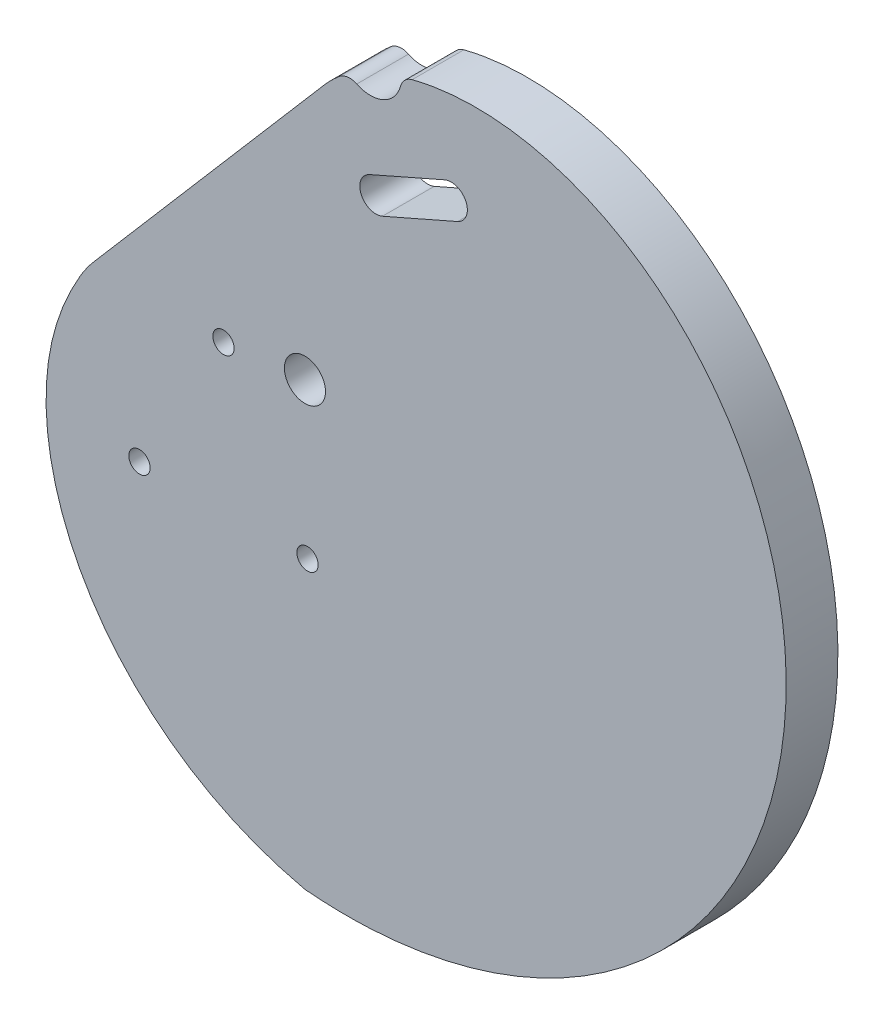
from build123d import *

# Parameters (mm, degrees)
SKETCH1_R             = 3.175
BOSS_EXTRUDE1_DEPTH   = 4
CUT_EXTRUDE1_START    = -4
CUT_EXTRUDE1_DEPTH    = 8
FILLET1_START         = -5
FILLET1_DEPTH         = 10
M4X0_7_TAPPED_HOLE1_D = 3.3
FILLET2_R             = 2.5


with BuildPart() as part:
    # Sketch1 → Boss-Extrude1 (new, symmetric)
    with BuildSketch(Plane.XY):
        with BuildLine():
            ThreePointArc((14.94525387, 48.021771818), (12.07211231, 43.542786085), (6.824607964, 44.425935993))
            add(Edge.make_bspline(
                [(6.824607964, 44.425935993), (6.611166223, 44.297424266), (6.111085767, 43.988924875), (5.336928158, 43.48349234), (4.507353656, 42.905954051), (3.699024971, 42.306520427), (2.912619563, 41.685826384), (2.149082762, 41.044776761), (1.408732666, 40.385653153), (0.69201842, 39.710962437), (-0.000702823, 39.023274092), (-0.669224606, 38.325164066), (-1.313490613, 37.619209289), (-1.933594741, 36.907981167), (-2.529780734, 36.194039342), (-3.102441662, 35.479925366), (-3.652119172, 34.768156406), (-4.179502537, 34.061218936), (-4.68542751, 33.361562432), (-5.170874981, 32.671593072), (-5.636969475, 31.993667421), (-6.084977486, 31.330086125), (-6.5163057, 30.68308757), (-6.932499191, 30.054841594), (-7.335239472, 29.447442991), (-7.726343211, 28.862905788), (-8.107759261, 28.30315506), (-8.481572996, 27.770028153), (-8.850055929, 27.265150233), (-9.21599154, 26.789707359), (-9.58007402, 26.342396401), (-9.943199031, 25.921274986), (-10.306211946, 25.524302901), (-10.669815304, 25.149428396), (-11.03457423, 24.794597749), (-11.400917427, 24.457759077), (-11.769139802, 24.136868148), (-12.139404915, 23.829894257), (-12.511747444, 23.534826559), (-12.886075425, 23.249680558), (-13.262172288, 22.972504592), (-13.639698706, 22.701386132), (-14.018194373, 22.4344578), (-14.397079826, 22.169903041), (-14.775658393, 21.905961469), (-15.153118349, 21.640933911), (-15.528535328, 21.37318718), (-15.900874865, 21.101158728), (-16.268995598, 20.823360748), (-16.631651048, 20.538385549), (-16.987497448, 20.244905703), (-17.335071725, 19.941700072), (-17.674482118, 19.629485326), (-18.005889299, 19.308945872), (-18.329486913, 18.98074786), (-18.645506177, 18.6455329), (-18.954213469, 18.303917657), (-19.255909475, 17.956492143), (-19.550927855, 17.603818409), (-19.839633983, 17.246429189), (-20.122423608, 16.884826615), (-20.39972148, 16.519480973), (-20.671979932, 16.15082951), (-20.93967742, 15.77927529), (-21.203317027, 15.405186109), (-21.463424922, 15.028893458), (-21.720548787, 14.650691546), (-21.975256201, 14.270836377), (-22.228133, 13.889544888), (-22.479781587, 13.506994147), (-22.730819224, 13.123320602), (-22.981876279, 12.738619403), (-23.233594452, 12.35294377), (-23.486624965, 11.966304432), (-23.741626724, 11.578669117), (-23.999264462, 11.189962103), (-24.260206854, 10.800063825), (-24.52512461, 10.408810538), (-24.794688561, 10.015994037), (-25.069567717, 9.621361426), (-25.350427363, 9.224614974), (-25.637926993, 8.8254119), (-25.932718851, 8.423364715), (-26.235444149, 8.018039723), (-26.546738212, 7.608962846), (-26.867193334, 7.195608336), (-27.197393741, 6.777566684), (-27.537037782, 6.353934602), (-27.885559202, 5.923803469), (-28.242374703, 5.486366009), (-28.606855737, 5.040842301), (-28.978345064, 4.586492757), (-29.356154138, 4.122615768), (-29.739565815, 3.648549546), (-30.127835637, 3.163672741), (-30.520193566, 2.667405334), (-30.915845631, 2.159209384), (-31.313975642, 1.638589743), (-31.713746908, 1.10509472), (-32.114303997, 0.558316687), (-32.514774496, -0.002107372), (-32.914270801, -0.576495363), (-33.311891916, -1.165119646), (-33.70672526, -1.768206653), (-34.097848491, -2.385936568), (-34.484331334, -3.01844306), (-34.865237414, -3.665813085), (-35.239626095, -4.328086735), (-35.606554319, -5.00525716), (-35.965078448, -5.697270543), (-36.314256102, -6.404026134), (-36.653147994, -7.125376348), (-36.98081976, -7.861126926), (-37.296343783, -8.611037148), (-37.598801011, -9.374820113), (-37.887282738, -10.15214308), (-38.160892488, -10.942627847), (-38.418747446, -11.745851279), (-38.659981522, -12.561345551), (-38.883742182, -13.388599746), (-39.089211497, -14.227059816), (-39.27554787, -15.076191303), (-39.442240692, -15.935443066), (-39.58900499, -16.804297383), (-39.715531283, -17.682274795), (-39.821534024, -18.56888584), (-39.906736403, -19.463633732), (-39.970874682, -20.366013757), (-40.01369729, -21.27551381), (-40.034965324, -22.191614638), (-40.034452659, -23.113790166), (-40.011946156, -24.041507803), (-39.967245835, -24.974228766), (-39.900165044, -25.911408403), (-39.810530622, -26.852496518), (-39.698183052, -27.796937709), (-39.56297661, -28.744171699), (-39.4047795, -29.693633681), (-39.223473982, -30.64475466), (-39.018956498, -31.596961802), (-38.791137779, -32.549678783), (-38.539942955, -33.502326148), (-38.265311644, -34.454321664), (-37.967198044, -35.405080681), (-37.645571006, -36.354016496), (-37.300414107, -37.300540716), (-36.931725709, -38.244063627), (-36.539519007, -39.18399456), (-36.123822074, -40.119742265), (-35.684677893, -41.050715279), (-35.222144381, -41.976322302), (-34.736294403, -42.89597257), (-34.227215775, -43.809076229), (-33.695011264, -44.715044715), (-33.139798572, -45.613291121), (-32.561710315, -46.503230581), (-31.960893988, -47.384280643), (-31.337511928, -48.255861642), (-30.69174126, -49.117397078), (-30.023773839, -49.96831399), (-29.333816181, -50.808043326), (-28.622089382, -51.636020317), (-27.888829033, -52.451684847), (-27.134285123, -53.25448182), (-26.358721931, -54.04386153), (-25.562417912, -54.819280022), (-24.745665571, -55.580199454), (-23.908771332, -56.326088459), (-23.052055394, -57.0564225), (-22.175851579, -57.770684224), (-21.280507172, -58.468363812), (-20.366382752, -59.148959324), (-19.433852012, -59.811977048), (-18.483301577, -60.456931829), (-17.515130802, -61.083347415), (-16.529751575, -61.690756781), (-15.527588097, -62.278702456), (-14.50907667, -62.846736843), (-13.474665463, -63.39442255), (-12.424814268, -63.921332635), (-11.359994294, -64.427051169), (-10.280687768, -64.911172569), (-9.187388219, -65.373305515), (-8.080598179, -65.813059652), (-6.960836498, -66.230096831), (-5.828609627, -66.623940268), (-4.684517934, -66.994691537), (-3.528855652, -67.340343195), (-2.3631095, -67.666856553), (-1.184338477, -67.950378607), (-0.400093515, -68.169065005), (0, -68.230921715)],
                knots=[0.585132093, 0.585132093, 0.585132093, 0.585132093, 0.58720527, 0.590021199, 0.59282457, 0.59561552, 0.598394199, 0.601160164, 0.603910525, 0.606641733, 0.609350191, 0.612032273, 0.614684334, 0.617302722, 0.619883791, 0.622423916, 0.624919509, 0.627367038, 0.629763043, 0.632104166, 0.634387177, 0.636609005, 0.638766786, 0.640857908, 0.642880081, 0.644831406, 0.646710483, 0.648516525, 0.650249514, 0.65191136, 0.653508519, 0.655048349, 0.65653798, 0.657984241, 0.659393583, 0.66077201, 0.662125022, 0.663457568, 0.664774018, 0.666078151, 0.667373165, 0.668661696, 0.669945853, 0.671227263, 0.672507127, 0.673786273, 0.67506522, 0.676344239, 0.677623416, 0.678902717, 0.68018205, 0.681461324, 0.682740438, 0.684019262, 0.685297659, 0.686575488, 0.687852615, 0.689128915, 0.690404281, 0.691678632, 0.692951916, 0.694224122, 0.695495279, 0.696765474, 0.698034846, 0.699303605, 0.70057203, 0.70184048, 0.703109399, 0.704379325, 0.705650892, 0.706924838, 0.708202013, 0.709483377, 0.710770009, 0.712063109, 0.713363997, 0.714674119, 0.715995039, 0.717328447, 0.718676146, 0.720040056, 0.721422204, 0.722824718, 0.724249822, 0.725699824, 0.727177002, 0.72868281, 0.730218172, 0.731783831, 0.733380363, 0.735008197, 0.736667628, 0.738358831, 0.740081872, 0.741836722, 0.743623264, 0.745441305, 0.747290584, 0.749170776, 0.751081502, 0.753022336, 0.754992805, 0.756992401, 0.759020578, 0.761076761, 0.763160347, 0.76527071, 0.767407202, 0.769569155, 0.771755887, 0.7739667, 0.776200882, 0.778457713, 0.780736462, 0.783036392, 0.785356757, 0.787696808, 0.790055792, 0.792432952, 0.794827532, 0.797238799, 0.799666426, 0.802110394, 0.804570687, 0.807047284, 0.809540165, 0.812049305, 0.814574675, 0.817116246, 0.819673984, 0.822247852, 0.824837811, 0.82744382, 0.830065834, 0.832703806, 0.835357687, 0.838027424, 0.840712962, 0.843414244, 0.84613121, 0.848863798, 0.851611942, 0.854375576, 0.857154631, 0.859949033, 0.862758708, 0.865583582, 0.868423573, 0.871278601, 0.874148584, 0.877033434, 0.879933066, 0.882847387, 0.885776307, 0.888719732, 0.891677564, 0.894649707, 0.897636058, 0.900636516, 0.903650977, 0.906679333, 0.909721476, 0.912777297, 0.915846682, 0.918929518, 0.922025687, 0.925135072, 0.928257554, 0.931393009, 0.934541315, 0.937702347, 0.940875975, 0.944062073, 0.947260508, 0.950471149, 0.95369386, 0.956928506, 0.960174949, 0.96343305, 0.966702667, 0.969983657, 0.973275876, 0.976579178, 0.979893415, 0.983218438, 0.986554095, 0.989900235, 0.993256703, 0.996623344, 1, 1, 1, 1], degree=3))
            add(Edge.make_bspline(
                [(0, -68.230921715), (0.393333706, -68.291733321), (1.194961176, -68.321276753), (2.388868431, -68.414811628), (3.58891617, -68.470136134), (4.791044831, -68.510535556), (5.995946289, -68.52954927), (7.203026535, -68.528713614), (8.412027616, -68.507423129), (9.62259203, -68.465654591), (10.83437986, -68.403235569), (12.047037443, -68.320041284), (13.260205927, -68.215942066), (14.473519127, -68.090817818), (15.686604264, -67.944554476), (16.899081946, -67.777045295), (18.110566359, -67.588190842), (19.320665416, -67.377899329), (20.528980925, -67.146086849), (21.73510877, -66.892677633), (22.938639087, -66.6176043), (24.139156466, -66.320808097), (25.336240146, -66.002239142), (26.529464226, -65.661856654), (27.718397887, -65.299629187), (28.90260561, -64.915534847), (30.081647414, -64.509561514), (31.255079097, -64.081707052), (32.42245248, -63.631979515), (33.58331567, -63.160397343), (34.737213315, -62.666989561), (35.883686879, -62.151795956), (37.022274916, -61.614867262), (38.152513354, -61.056265327), (39.273935784, -60.476063279), (40.386073758, -59.87434568), (41.488457085, -59.251208675), (42.580614147, -58.606760131), (43.662072205, -57.941119771), (44.732357722, -57.254419292), (45.790996682, -56.546802486), (46.837514925, -55.81842534), (47.871438475, -55.069456136), (48.89229388, -54.300075538), (49.899608554, -53.51047667), (50.892911122, -52.700865183), (51.871731772, -51.87145932), (52.835602603, -51.022489959), (53.784057989, -50.154200657), (54.71663493, -49.26684768), (55.632873421, -48.360700021), (56.532316811, -47.436039411), (57.414512174, -46.493160317), (58.279010671, -45.532369935), (59.125367928, -44.553988165), (59.953144401, -43.558347582), (60.761905749, -42.545793391), (61.55122321, -41.516683378), (62.320673971, -40.471387842), (63.069841543, -39.410289525), (63.798316132, -38.333783527), (64.505695017, -37.242277204), (65.191582915, -36.13619007), (65.85559236, -35.015953676), (66.497344063, -33.882011479), (67.11646729, -32.734818707), (67.71260022, -31.574842209), (68.285390316, -30.402560293), (68.834494677, -29.218462553), (69.359580408, -28.023049692), (69.860324965, -26.816833323), (70.336416512, -25.60033577), (70.787554269, -24.374089852), (71.213448854, -23.13863866), (71.613822626, -21.894535318), (71.988410015, -20.642342743), (72.336957858, -19.382633384), (72.659225719, -18.115988959), (72.954986211, -16.843000179), (73.224025309, -15.564266461), (73.466142659, -14.28039563), (73.681151874, -12.992003617), (73.868880836, -11.699714142), (74.029171977, -10.404158388), (74.161882563, -9.10597467), (74.266884966, -7.805808087), (74.344066927, -6.504310174), (74.393331816, -5.202138538), (74.414598879, -3.89995649), (74.407803478, -2.598432666), (74.372897323, -1.29824064), (74.309848696, -5.853e-05), (74.218642658, 1.295431404), (74.099281259, 2.587543173), (73.95178373, 3.875587471), (73.776186663, 5.158872107), (73.572544188, 6.43670243), (73.340928136, 7.708381771), (73.081428188, 8.973211889), (72.794152019, 10.230493418), (72.47922543, 11.479526328), (72.13679246, 12.719610386), (71.767015501, 13.950045625), (71.37007539, 15.170132817), (70.946171493, 16.379173951), (70.495521777, 17.576472716), (70.018362872, 18.761334989), (69.514950114, 19.933069325), (68.985557583, 21.090987453), (68.430478125, 22.234404772), (67.850023359, 23.362640855), (67.244523678, 24.47501995), (66.614328227, 25.570871489), (65.959804877, 26.649530597), (65.281340181, 27.710338599), (64.579339317, 28.752643533), (63.85422602, 29.775800665), (63.106442497, 30.779173), (62.33644933, 31.762131799), (61.544725366, 32.724057086), (60.731767601, 33.66433818), (59.898090995, 34.582374149), (59.044228508, 35.477574541), (58.170730235, 36.349359075), (57.278166357, 37.197160694), (56.367121668, 38.020410915), (55.438270074, 38.818621759), (54.492318121, 39.591335254), (53.529982536, 40.3381068), (52.551992493, 41.058512637), (51.559087829, 41.752148676), (50.552018856, 42.418631155), (49.531545735, 43.057596786), (48.498437965, 43.668703015), (47.453473832, 44.251628246), (46.397439863, 44.806072049), (45.331130274, 45.331755356), (44.255346411, 45.828420647), (43.17089619, 46.295832116), (42.078593533, 46.733775825), (40.979257798, 47.142059848), (39.873713209, 47.520514394), (38.762788284, 47.868991924), (37.647315256, 48.187367242), (36.528129497, 48.475537585), (35.406068937, 48.733422689), (34.281973488, 48.960964845), (33.156684455, 49.158128938), (32.031043959, 49.324902476), (30.905894352, 49.461295599), (29.78207764, 49.567341079), (28.66043489, 49.643094299), (27.541805663, 49.688633226), (26.427027423, 49.704058363), (25.316934962, 49.689492689), (24.212359828, 49.645081585), (23.114129743, 49.570992746), (22.023068037, 49.46741608), (20.939993076, 49.334563587), (19.865717696, 49.172669234), (18.801048645, 48.981988806), (17.746786017, 48.762799751), (16.703722704, 48.515401007), (15.7707146, 48.26629677), (15.186932522, 48.095241394), (14.94525387, 48.021771818)],
                knots=[0, 0, 0, 0, 0.003319606, 0.00664483, 0.00997572, 0.013312315, 0.016654652, 0.020002764, 0.023356679, 0.026716422, 0.030082012, 0.033453467, 0.036830797, 0.040214011, 0.043603114, 0.046998106, 0.050398984, 0.05380574, 0.057218364, 0.060636841, 0.064061153, 0.067491279, 0.070927192, 0.074368865, 0.077816264, 0.081269354, 0.084728096, 0.088192446, 0.09166236, 0.095137787, 0.098618675, 0.102104968, 0.105596607, 0.10909353, 0.112595671, 0.116102963, 0.119615332, 0.123132706, 0.126655005, 0.130182149, 0.133714056, 0.137250637, 0.140791804, 0.144337465, 0.147887524, 0.151441884, 0.155000443, 0.158563099, 0.162129745, 0.165700272, 0.169274569, 0.172852522, 0.176434014, 0.180018926, 0.183607137, 0.187198521, 0.190792953, 0.194390304, 0.197990441, 0.201593231, 0.205198539, 0.208806224, 0.212416148, 0.216028167, 0.219642135, 0.223257906, 0.226875331, 0.230494258, 0.234114533, 0.237736001, 0.241358506, 0.244981886, 0.248605983, 0.252230632, 0.255855669, 0.259480928, 0.263106241, 0.266731437, 0.270356345, 0.273980794, 0.277604607, 0.281227611, 0.284849627, 0.288470478, 0.292089983, 0.295707963, 0.299324234, 0.302938615, 0.306550921, 0.310160967, 0.313768569, 0.317373538, 0.320975689, 0.324574833, 0.328170782, 0.331763348, 0.335352341, 0.338937573, 0.342518853, 0.346095993, 0.349668803, 0.353237093, 0.356800674, 0.360359359, 0.363912958, 0.367461284, 0.37100415, 0.37454137, 0.37807276, 0.381598135, 0.385117313, 0.388630113, 0.392136355, 0.395635862, 0.399128458, 0.402613969, 0.406092224, 0.409563054, 0.413026294, 0.416481778, 0.419929348, 0.423368847, 0.426800121, 0.43022302, 0.4336374, 0.437043112, 0.440439966, 0.443827754, 0.447206268, 0.450575308, 0.453934675, 0.457284173, 0.460623612, 0.463952804, 0.467271567, 0.470579721, 0.473877092, 0.477163509, 0.480438807, 0.483702825, 0.486955407, 0.490196401, 0.493425661, 0.496643048, 0.499848424, 0.50304166, 0.506222633, 0.509391223, 0.512547319, 0.515690814, 0.518821608, 0.521939609, 0.52504473, 0.528136891, 0.531216019, 0.53428205, 0.537334925, 0.540374595, 0.543401017, 0.546414157, 0.549413988, 0.552400493, 0.555373664, 0.5583335, 0.560435437, 0.560435437, 0.560435437, 0.560435437], degree=3))
        make_face()
        Circle(SKETCH1_R, mode=Mode.SUBTRACT)
        with BuildLine():
            ThreePointArc((11.984914181, 27.895733584), (8.691133377, 29.180649151), (9.976048944, 32.474429955))
            Line((9.976048944, 32.474429955), (21.605937727, 37.576947657))
            ThreePointArc((21.605937727, 37.576947657), (24.899718531, 36.29203209), (23.614802964, 32.998251286))
            Line((23.614802964, 32.998251286), (11.984914181, 27.895733584))
        make_face(mode=Mode.SUBTRACT)
    extrude(amount=BOSS_EXTRUDE1_DEPTH, both=True)

    # Sketch2 → Cut-Extrude1 (cut)
    with BuildSketch(Plane.XY.offset(CUT_EXTRUDE1_START)):
        Polygon((4.833037594, 43.130944449), (-33.665262713, -1.70731465), (-6.861868576, 43.130944449), align=None)
    extrude(amount=CUT_EXTRUDE1_DEPTH, mode=Mode.SUBTRACT)

    # Fillet1: read off the stored shape, not the designer's step
    # Fillet1 outline → Fillet1 (cut)
    with BuildSketch(Plane.XY.offset(FILLET1_START)):
        with BuildLine():
            add(Edge.make_bspline(
                [(-33.665262713, -1.70731465), (-33.677962215, -1.726972467), (-33.822754696, -1.951460543), (-34.097848491, -2.385936568), (-34.447383574, -2.957975438), (-34.664608399, -3.325164923), (-34.755069569, -3.480236719)],
                knots=[0.756797653, 0.756797653, 0.756797653, 0.756797653, 0.756992401, 0.759020578, 0.761076761, 0.762570691, 0.762570691, 0.762570691, 0.762570691], degree=3))
            ThreePointArc((-34.755069569, -3.480236719), (-33.771382384, -1.957080562), (-32.653791354, -0.529272646))
            Line((-32.653791354, -0.529272646), (-33.665262713, -1.70731465))
        make_face()
        with BuildLine():
            Line((4.833037545, 43.130944414), (2.980542079, 40.973377148))
            ThreePointArc((2.980542079, 40.973377148), (4.790611786, 42.824316011), (6.824607964, 44.425935993))
            add(Edge.make_bspline(
                [(6.824607964, 44.425935993), (6.611166223, 44.297424266), (6.111085767, 43.988924875), (5.447825127, 43.555894827), (5.000467699, 43.248311471), (4.833037545, 43.130944414)],
                knots=[0.585132093, 0.585132093, 0.585132093, 0.585132093, 0.58720527, 0.590021199, 0.591722633, 0.591722633, 0.591722633, 0.591722633], degree=3))
        make_face()
    extrude(amount=FILLET1_DEPTH, mode=Mode.SUBTRACT)

    # M4x0.7 Tapped Hole1 (through all)
    with Locations(Plane.XY.offset(4)):
        with Locations((-12.593900177, -1.272585975), (0.396480879, -23.772585975), (-25.584281234, -23.772585975)):
            Hole(M4X0_7_TAPPED_HOLE1_D / 2)

    # Fillet2
    fillet2_edges = [part.edges().sort_by_distance(p)[0] for p in [
        (14.94525387, 48.021771818, -2),
        (6.824607964, 44.425935993, 0),
    ]]
    fillet(fillet2_edges, radius=FILLET2_R)


solid = part.part
